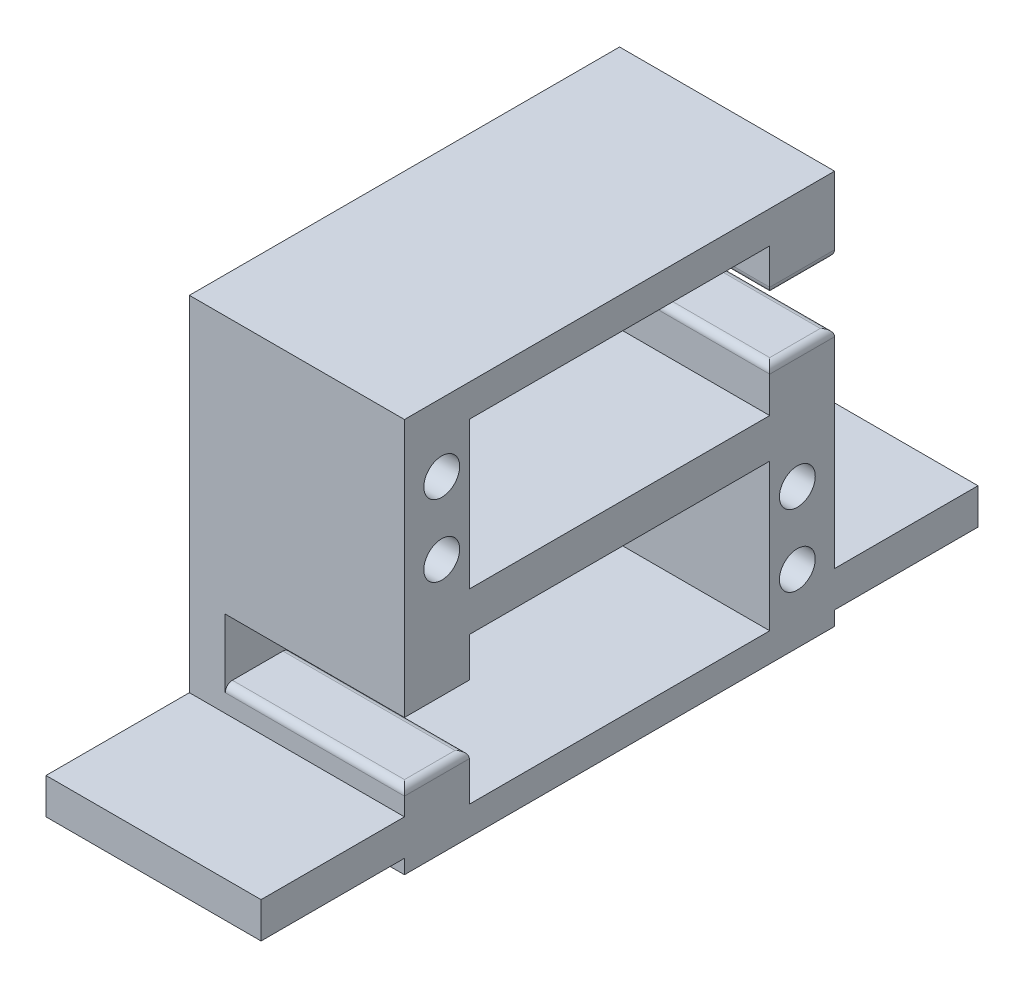
from build123d import *

# Parameters (mm, degrees)
SKETCH1_W                 = 43
SKETCH1_H                 = 60
BOSS_EXTRUDE1_DEPTH       = 55
SKETCH2_W                 = 41.9
SKETCH2_H                 = 20.5
SKETCH2_H_2               = 20
CUT_EXTRUDE1_DEPTH        = 38
SKETCH3_W                 = 9.05
SKETCH3_H                 = 8.5
CUT_EXTRUDE2_DEPTH        = 38
BOSS_EXTRUDE5_START       = -0.874015748
BOSS_EXTRUDE5_OUTLINE_W   = 2.5
BOSS_EXTRUDE5_OUTLINE_H   = 41.9
BOSS_EXTRUDE5_OUTLINE_W_2 = 5
BOSS_EXTRUDE5_OUTLINE_H_2 = 20
BOSS_EXTRUDE5_DEPTH       = 30
SKETCH18_R                = 2.5
CUT_EXTRUDE9_DEPTH        = 10
SKETCH19_R                = 2.5
CUT_EXTRUDE10_DEPTH       = 10
SKETCH20_W                = 41.9
SKETCH20_H                = 5
CUT_EXTRUDE11_DEPTH       = 25
SKETCH21_W                = 60
SKETCH21_H                = 55
CUT_EXTRUDE12_DEPTH       = 13
SKETCH22_W                = 41.9
SKETCH22_H                = 2
BOSS_EXTRUDE6_DEPTH       = 25
FILLET4_R                 = 1
FILLET5_R                 = 1


# Read off the part's stored shape, not the designer's step: Boss-Extrude5
with BuildPart() as part:
    # Sketch1 → Boss-Extrude1 (new body)
    with BuildSketch(Plane(origin=(0, 0, 0), x_dir=(1, 0, 0), z_dir=(0, 1, 0))):
        with Locations((20.625984252, 7.362204724)):
            Rectangle(SKETCH1_W, SKETCH1_H)
    extrude(amount=BOSS_EXTRUDE1_DEPTH)

    # Sketch2 → Cut-Extrude1 (cut)
    with BuildSketch(Plane(origin=(42.125984252, 0, 0), x_dir=(0, 0, -1), z_dir=(1, 0, 0))):
        with Locations((7.362204724, 40.25)):
            Rectangle(SKETCH2_W, SKETCH2_H)
        with Locations((7.362204724, 14.5)):
            Rectangle(SKETCH2_W, SKETCH2_H_2)
    extrude(amount=-CUT_EXTRUDE1_DEPTH, mode=Mode.SUBTRACT)

    # Sketch3 → Cut-Extrude2 (cut)
    with BuildSketch(Plane(origin=(42.125984252, 0, 0), x_dir=(0, 0, -1), z_dir=(1, 0, 0))):
        with Locations((-18.112795276, 14.75)):
            Rectangle(SKETCH3_W, SKETCH3_H)
        with Locations((32.837204724, 40.25)):
            Rectangle(SKETCH3_W, SKETCH3_H)
    extrude(amount=-CUT_EXTRUDE2_DEPTH, mode=Mode.SUBTRACT)

    # Boss-Extrude5 outline → Boss-Extrude5 (add)
    with BuildSketch(Plane.YZ.offset(BOSS_EXTRUDE5_START)):
        with Locations((5.75, -7.362204724)):
            Rectangle(BOSS_EXTRUDE5_OUTLINE_W, BOSS_EXTRUDE5_OUTLINE_H)
        with Locations((4.5, -47.362204724)):
            Rectangle(BOSS_EXTRUDE5_OUTLINE_W_2, BOSS_EXTRUDE5_OUTLINE_H_2)
        with Locations((4.5, 32.637795276)):
            Rectangle(BOSS_EXTRUDE5_OUTLINE_W_2, BOSS_EXTRUDE5_OUTLINE_H_2)
    extrude(amount=BOSS_EXTRUDE5_DEPTH)

    # Sketch18 → Cut-Extrude9 (cut)
    with BuildSketch(Plane(origin=(29.125984252, 0, 0), x_dir=(0, 0, -1), z_dir=(1, 0, 0))):
        with Locations((-17.437795276, 45.5)):
            Circle(SKETCH18_R)
        with Locations((-17.437795276, 35.5)):
            Circle(SKETCH18_R)
    extrude(amount=-CUT_EXTRUDE9_DEPTH, mode=Mode.SUBTRACT)

    # Sketch19 → Cut-Extrude10 (cut)
    with BuildSketch(Plane(origin=(29.125984252, 0, 0), x_dir=(0, 0, -1), z_dir=(1, 0, 0))):
        with Locations((32.162204724, 19.5)):
            Circle(SKETCH19_R)
        with Locations((32.162204724, 9.5)):
            Circle(SKETCH19_R)
    extrude(amount=-CUT_EXTRUDE10_DEPTH, mode=Mode.SUBTRACT)

    # Sketch20 → Cut-Extrude11 (cut)
    with BuildSketch(Plane(origin=(29.125984252, 0, 0), x_dir=(0, 0, -1), z_dir=(1, 0, 0))):
        with Locations((7.362204724, 4.5)):
            Rectangle(SKETCH20_W, SKETCH20_H)
    extrude(amount=-CUT_EXTRUDE11_DEPTH, mode=Mode.SUBTRACT)

    # Sketch21 → Cut-Extrude12 (cut)
    with BuildSketch(Plane(origin=(42.125984252, 0, 0), x_dir=(0, 0, -1), z_dir=(1, 0, 0))):
        with Locations((7.362204724, 27.5)):
            Rectangle(SKETCH21_W, SKETCH21_H)
    extrude(amount=-CUT_EXTRUDE12_DEPTH, mode=Mode.SUBTRACT)

    # Sketch22 → Boss-Extrude6 (add)
    with BuildSketch(Plane(origin=(4.125984252, 0, 0), x_dir=(0, 0, -1), z_dir=(1, 0, 0))):
        with Locations((7.362204724, 3)):
            Rectangle(SKETCH22_W, SKETCH22_H)
    extrude(amount=BOSS_EXTRUDE6_DEPTH)

    # Fillet4
    fillet4_edges = [part.edges().sort_by_distance(p)[0] for p in [
        (29.125984252, 44.5, -32.837204724),
        (29.125984252, 36, -32.837204724),
        (16.625984252, 36, -28.312204724),
        (16.625984252, 44.5, -28.312204724),
        (16.625984252, 44.5, -37.362204724),
        (16.625984252, 36, -37.362204724),
    ]]
    fillet(fillet4_edges, radius=FILLET4_R)

    # Fillet5
    fillet5_edges = [part.edges().sort_by_distance(p)[0] for p in [
        (29.125984252, 10.5, 18.112795276),
        (16.625984252, 10.5, 22.637795276),
        (16.625984252, 10.5, 13.587795276),
    ]]
    fillet(fillet5_edges, radius=FILLET5_R)


solid = part.part
